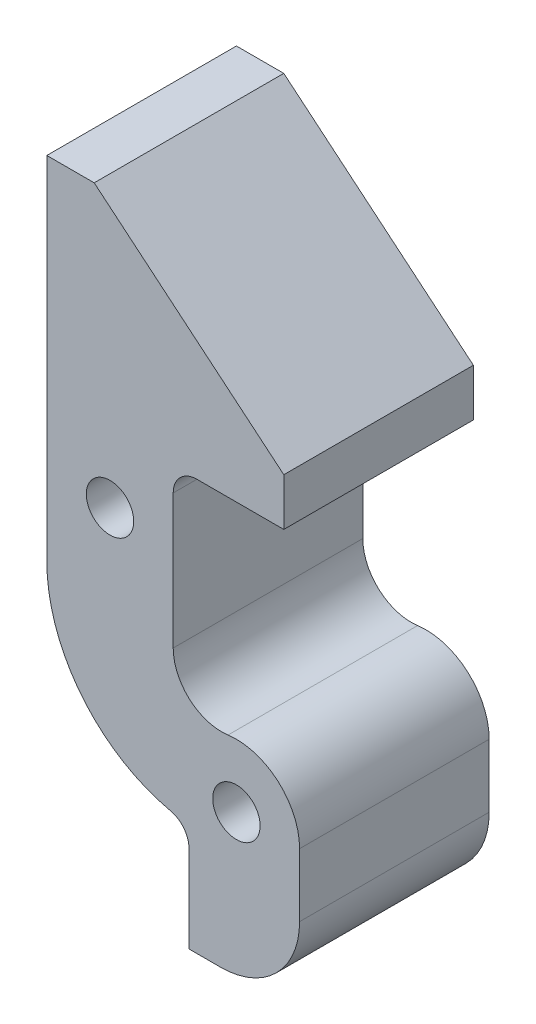
from build123d import *

# Parameters (mm, degrees)
SKETCH_1_R          = 1.5
EXTRUDE_1_DEPTH     = 12
FILLET_1_R          = 1.5
EXTRUDE_2_DEPTH     = 12
SKETCH_3_W          = 12
SKETCH_3_H          = 7
EXTRUDE_4_DEPTH     = 3
FILLET_3_R          = 5
SKETCH_4_R          = 1.5
CUT_EXTRUDE_1_DEPTH = 35.467375879
FILLET_4_R          = 10
FILLET_5_R          = 10


with BuildPart() as part:
    # 草图1 → 凸台-拉伸1 (new body)
    with BuildSketch(Plane.XY):
        with BuildLine():
            Line((-4, 7), (-4, 17))
            Line((-4, 17), (3, 17))
            Line((3, 17), (3, 20))
            Line((3, 20), (-9, 30))
            Line((-9, 30), (-12, 30))
            Line((-12, 30), (-12, 7))
            ThreePointArc((-12, 7), (-8.222207225, -1.325379685), (0.530973451, -3.96460177))
            ThreePointArc((0.530973451, -3.96460177), (3.96460177, 0.530973451), (-0.530973451, 3.96460177))
            ThreePointArc((-0.530973451, 3.96460177), (-2.954170362, 4.695233872), (-4, 7))
        make_face()
        Circle(SKETCH_1_R, mode=Mode.SUBTRACT)
        with Locations((-8, 12.68857754)):
            Circle(SKETCH_1_R, mode=Mode.SUBTRACT)
    extrude(amount=EXTRUDE_1_DEPTH)

    # 圆角1
    fillet_1_edges = [part.edges().sort_by_distance(p)[0] for p in [
        (-4, 17, 6),
    ]]
    fillet(fillet_1_edges, radius=FILLET_1_R)

    # 草图2 → 凸台-拉伸2 (add)
    with BuildSketch(Plane(origin=(0, 0, 0), x_dir=(-1, 0, 0), z_dir=(0, 0, -1))):
        Polygon((-4, 0), (-4, -9), (0, -9), (0, -4.022703843), align=None)
    extrude(amount=-EXTRUDE_2_DEPTH)

    # 草图3 → 凸台-拉伸4 (add)
    with BuildSketch(Plane.ZY):
        with Locations((6, -5.5)):
            Rectangle(SKETCH_3_W, SKETCH_3_H)
    extrude(amount=EXTRUDE_4_DEPTH)

    # 圆角3
    fillet_3_edges = [part.edges().sort_by_distance(p)[0] for p in [
        (4, -9, 6),
    ]]
    fillet(fillet_3_edges, radius=FILLET_3_R)

    # 草图4 → 切除-拉伸1 (cut, through all)
    with BuildSketch(Plane(origin=(0, 0, 0), x_dir=(-1, 0, 0), z_dir=(0, 0, -1))):
        with Locations((4.5, -3.473180033)):
            Circle(SKETCH_4_R)
    extrude(amount=-CUT_EXTRUDE_1_DEPTH, mode=Mode.SUBTRACT)

    # 圆角4
    fillet_4_edges = [part.edges().sort_by_distance(p)[0] for p in [
        (-5.884075597, -2.894963169, 6),
    ]]
    fillet(fillet_4_edges, radius=FILLET_4_R)

    # 圆角5
    # the kernel refuses this fillet: 10 mm, written as the material it takes off along each edge
    with BuildSketch(Plane(origin=(-3.050425983, -3.858842021, 12.906172426), x_dir=(0.1384631917279628, 0.990367580515692, 0), z_dir=(0, 0, -1))) as fillet_5_piece_1:
        with BuildLine():
            CenterArc((1.570698872, 9.926740679), FILLET_5_R, 260.94796551, 2.112432444)
            ThreePointArc((-0.002615053, 0.051282042), (-0.001337281, 0.025639504), (0, 0))
            ThreePointArc((0, 0), (0.181234485, 0.010988898), (0.36246897, 0))
        make_face()
    extrude(amount=13.812344852, mode=Mode.SUBTRACT)


solid = part.part
